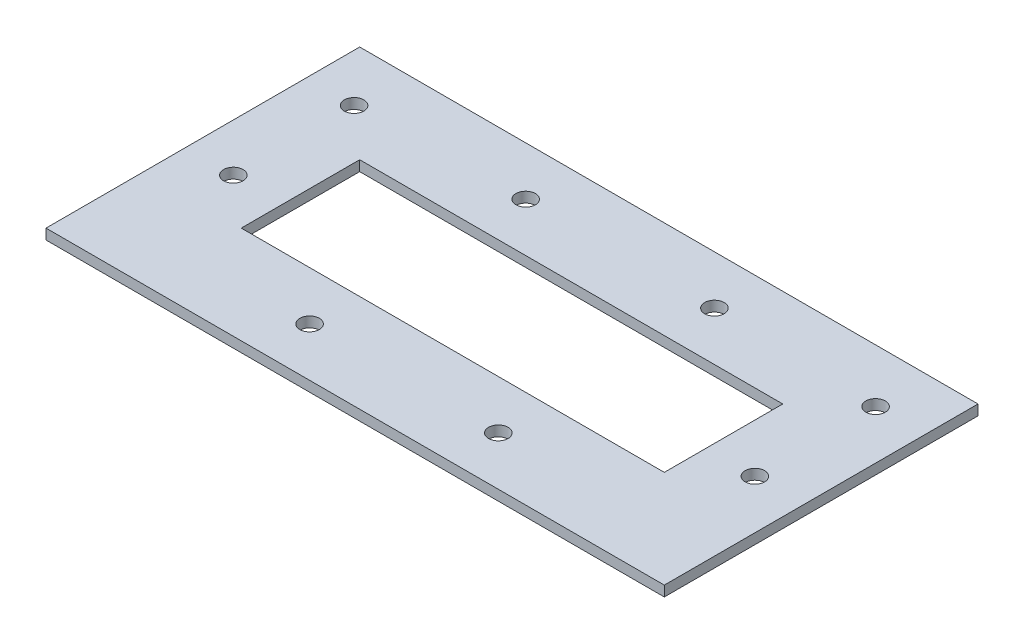
from build123d import *

# Parameters (mm, degrees)
SKETCH2_W           = 94.999999992
SKETCH2_H           = 48.197360298
SKETCH2_R           = 1.5
SKETCH2_W_2         = 64.999999992
SKETCH2_H_2         = 18.197360298
BOSS_EXTRUDE2_DEPTH = 1.5875


with BuildPart() as part:
    # Sketch2 → Boss-Extrude2 (new body)
    with BuildSketch(Plane(origin=(0, 0, 0), x_dir=(1, 0, 0), z_dir=(0, 1, 0))):
        Rectangle(SKETCH2_W, SKETCH2_H)
        with Locations((-14.499999996, 16.598680149)):
            Circle(SKETCH2_R, mode=Mode.SUBTRACT)
        with Locations((14.499999996, 16.598680149)):
            Circle(SKETCH2_R, mode=Mode.SUBTRACT)
        with Locations((-40.148974228, 15.881761887)):
            Circle(SKETCH2_R, mode=Mode.SUBTRACT)
        with Locations((-40.148974228, -2.662696697)):
            Circle(SKETCH2_R, mode=Mode.SUBTRACT)
        with Locations((39.978852734, 15.881761887)):
            Circle(SKETCH2_R, mode=Mode.SUBTRACT)
        with Locations((39.978852734, -2.662696697)):
            Circle(SKETCH2_R, mode=Mode.SUBTRACT)
        with Locations((-14.499999996, -16.598680149)):
            Circle(SKETCH2_R, mode=Mode.SUBTRACT)
        with Locations((14.499999996, -16.598680149)):
            Circle(SKETCH2_R, mode=Mode.SUBTRACT)
        Rectangle(SKETCH2_W_2, SKETCH2_H_2, mode=Mode.SUBTRACT)
    extrude(amount=BOSS_EXTRUDE2_DEPTH)


solid = part.part
